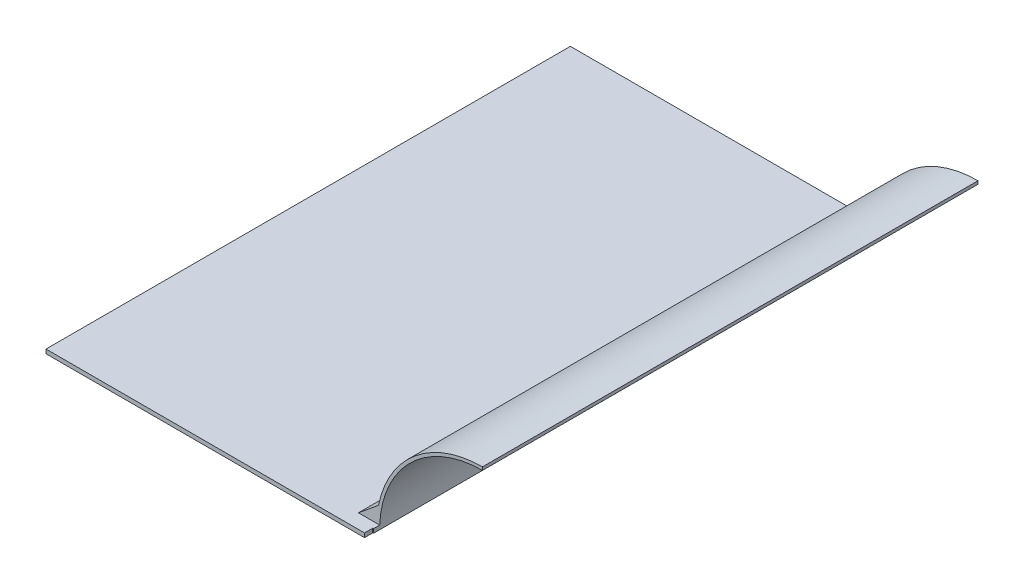
from build123d import *

# Parameters (mm, degrees)
BOSS_EXTRUDE1_DEPTH = 122.5
BOSS_EXTRUDE2_DEPTH = 5
FILLET1_R           = 0.6
BOSS_EXTRUDE3_DEPTH = 5
SKETCH6_W           = 154.900501524
SKETCH6_H           = 4.066396164
BOSS_EXTRUDE4_DEPTH = 5
CUT_EXTRUDE1_START  = -4
CUT_EXTRUDE1_DEPTH  = 4
BOSS_EXTRUDE5_START = 1
BOSS_EXTRUDE5_DEPTH = 1
CUT_EXTRUDE2_DEPTH  = 10
CUT_EXTRUDE3_DEPTH  = 1.066396
CUT_EXTRUDE4_DEPTH  = 1
CHAMFER1_START      = -123.5
CHAMFER1_DEPTH      = 247
SKETCH15_W          = 64.575281
SKETCH15_H          = 7
SKETCH15_W_2        = 62.115122
CUT_EXTRUDE5_DEPTH  = 70


with BuildPart() as part:
    # Sketch1 → Boss-Extrude1 (new, symmetric)
    with BuildSketch(Plane.XY):
        with BuildLine():
            Line((76.956830849, 0), (-76.956830849, 0))
            Line((-76.956830849, 0), (-76.956830849, -4.066396164))
            Line((-76.956830849, -4.066396164), (78.296976713, -4.066396164))
            ThreePointArc((78.296976713, -4.066396164), (92.937456554, 31.296585381), (128.296975316, 45.945426519))
            Line((128.296975316, 45.945426519), (128.296975316, 47.445426519))
            ThreePointArc((128.296975316, 47.445426519), (93.343867688, 33.767777941), (76.956830849, 0))
        make_face()
    extrude(amount=BOSS_EXTRUDE1_DEPTH, both=True)

    # Sketch4 → Boss-Extrude2 (add, symmetric)
    with BuildSketch(Plane.XY):
        Polygon((-75.056329325, -5), (-72.325824204, -5), (-71.690241182, -6.74625), (-71.191912346, -6.74625), (-70.556329325, -5), (-69.825824204, -5), (-69.190241182, -6.74625), (-68.691912346, -6.74625), (-68.056329325, -5), (-67.325824204, -5), (-66.690241182, -6.74625), (-66.191912346, -6.74625), (-65.556329325, -5), (-64.825824204, -5), (-64.190241182, -6.74625), (-63.691912346, -6.74625), (-63.056329325, -5), (-62.325824204, -5), (-61.690241182, -6.74625), (-61.191912346, -6.74625), (-60.556329325, -5), (-59.825824204, -5), (-59.190241182, -6.74625), (-58.691912346, -6.74625), (-58.056329325, -5), (-57.325824204, -5), (-56.690241182, -6.74625), (-56.191912346, -6.74625), (-55.556329325, -5), (-54.825824204, -5), (-54.190241182, -6.74625), (-53.691912346, -6.74625), (-53.056329325, -5), (-52.325824204, -5), (-51.690241182, -6.74625), (-51.191912346, -6.74625), (-50.556329325, -5), (-49.825824204, -5), (-49.190241182, -6.74625), (-48.691912346, -6.74625), (-48.056329325, -5), (-47.325824204, -5), (-46.690241182, -6.74625), (-46.191912346, -6.74625), (-45.556329325, -5), (-44.825824204, -5), (-44.190241182, -6.74625), (-43.691912346, -6.74625), (-43.056329325, -5), (-42.325824204, -5), (-41.690241182, -6.74625), (-41.191912346, -6.74625), (-40.556329325, -5), (-39.825824204, -5), (-39.190241182, -6.74625), (-38.691912346, -6.74625), (-38.056329325, -5), (-37.325824204, -5), (-36.690241182, -6.74625), (-36.191912346, -6.74625), (-35.556329325, -5), (-34.825824204, -5), (-34.190241182, -6.74625), (-33.691912346, -6.74625), (-33.056329325, -5), (-32.325824204, -5), (-31.690241182, -6.74625), (-31.191912346, -6.74625), (-30.556329325, -5), (-29.825824204, -5), (-29.190241182, -6.74625), (-28.691912346, -6.74625), (-28.056329325, -5), (-27.325824204, -5), (-26.690241182, -6.74625), (-26.191912346, -6.74625), (-25.556329325, -5), (-24.825824204, -5), (-24.190241182, -6.74625), (-23.691912346, -6.74625), (-23.056329325, -5), (-22.325824204, -5), (-21.690241182, -6.74625), (-21.191912346, -6.74625), (-20.556329325, -5), (-19.825824204, -5), (-19.190241182, -6.74625), (-18.691912346, -6.74625), (-18.056329325, -5), (-17.325824204, -5), (-16.690241182, -6.74625), (-16.191912346, -6.74625), (-15.556329325, -5), (-14.825824204, -5), (-14.190241182, -6.74625), (-13.691912346, -6.74625), (-13.056329325, -5), (-12.325824204, -5), (-11.690241182, -6.74625), (-11.191912346, -6.74625), (-10.556329325, -5), (-9.825824204, -5), (-9.190241182, -6.74625), (-8.691912346, -6.74625), (-8.056329325, -5), (-7.325824204, -5), (-6.690241182, -6.74625), (-6.191912346, -6.74625), (-5.556329325, -5), (-4.825824204, -5), (-4.190241182, -6.74625), (-3.691912346, -6.74625), (-3.056329325, -5), (-2.325824204, -5), (-1.690241182, -6.74625), (-1.191912346, -6.74625), (-0.556329325, -5), (0.174175796, -5), (0.809758818, -6.74625), (1.308087654, -6.74625), (1.943670675, -5), (2.674175796, -5), (3.309758818, -6.74625), (3.808087654, -6.74625), (4.443670675, -5), (5.174175796, -5), (5.809758818, -6.74625), (6.308087654, -6.74625), (6.943670675, -5), (7.674175796, -5), (8.309758818, -6.74625), (8.808087654, -6.74625), (9.443670675, -5), (10.174175796, -5), (10.809758818, -6.74625), (11.308087654, -6.74625), (11.943670675, -5), (12.674175796, -5), (13.309758818, -6.74625), (13.808087654, -6.74625), (14.443670675, -5), (15.174175796, -5), (15.809758818, -6.74625), (16.308087654, -6.74625), (16.943670675, -5), (17.674175796, -5), (18.309758818, -6.74625), (18.808087654, -6.74625), (19.443670675, -5), (20.174175796, -5), (20.809758818, -6.74625), (21.308087654, -6.74625), (21.943670675, -5), (22.674175796, -5), (23.309758818, -6.74625), (23.808087654, -6.74625), (24.443670675, -5), (25.174175796, -5), (25.809758818, -6.74625), (26.308087654, -6.74625), (26.943670675, -5), (27.674175796, -5), (28.309758818, -6.74625), (28.808087654, -6.74625), (29.443670675, -5), (30.174175796, -5), (30.809758818, -6.74625), (31.308087654, -6.74625), (31.943670675, -5), (32.674175796, -5), (33.309758818, -6.74625), (33.808087654, -6.74625), (34.443670675, -5), (35.174175796, -5), (35.809758818, -6.74625), (36.308087654, -6.74625), (36.943670675, -5), (37.674175796, -5), (38.309758818, -6.74625), (38.808087654, -6.74625), (39.443670675, -5), (40.174175796, -5), (40.809758818, -6.74625), (41.308087654, -6.74625), (41.943670675, -5), (42.674175796, -5), (43.309758818, -6.74625), (43.808087654, -6.74625), (44.443670675, -5), (45.174175796, -5), (45.809758818, -6.74625), (46.308087654, -6.74625), (46.943670675, -5), (47.674175796, -5), (48.309758818, -6.74625), (48.808087654, -6.74625), (49.443670675, -5), (50.174175796, -5), (50.809758818, -6.74625), (51.308087654, -6.74625), (51.943670675, -5), (52.674175796, -5), (53.309758818, -6.74625), (53.808087654, -6.74625), (54.443670675, -5), (55.174175796, -5), (55.809758818, -6.74625), (56.308087654, -6.74625), (56.943670675, -5), (57.674175796, -5), (58.309758818, -6.74625), (58.808087654, -6.74625), (59.443670675, -5), (60.174175796, -5), (60.809758818, -6.74625), (61.308087654, -6.74625), (61.943670675, -5), (62.674175796, -5), (63.309758818, -6.74625), (63.808087654, -6.74625), (64.443670675, -5), (65.174175796, -5), (65.809758818, -6.74625), (66.308087654, -6.74625), (66.943670675, -5), (67.674175796, -5), (68.309758818, -6.74625), (68.808087654, -6.74625), (69.443670675, -5), (70.174175796, -5), (70.809758818, -6.74625), (71.308087654, -6.74625), (71.943670675, -5), (71.943670675, -4.066396164), (-75.056329325, -4.066396164), align=None)
    extrude(amount=BOSS_EXTRUDE2_DEPTH, both=True)

    # Fillet1
    fillet1_edges = [part.edges().sort_by_distance(p)[0] for p in [
        (-1.556329325, -4.066396164, -5),
        (71.943670675, -4.066396164, 0),
        (-1.556329325, -4.066396164, 5),
    ]]
    fillet(fillet1_edges, radius=FILLET1_R)

    # Sketch5 → Boss-Extrude3 (add)
    with BuildSketch(Plane(origin=(0, 0, -122.5), x_dir=(-1, 0, 0), z_dir=(0, 0, -1))):
        with BuildLine():
            ThreePointArc((-128.296975316, 45.945426519), (-92.937456554, 31.296585381), (-78.296976713, -4.066396164))
            Line((-78.296976713, -4.066396164), (76.956830849, -4.066396164))
            Line((76.956830849, -4.066396164), (76.956830849, 0))
            Line((76.956830849, 0), (-76.956830849, 0))
            ThreePointArc((-76.956830849, 0), (-93.343867688, 33.767777941), (-128.296975316, 47.445426519))
            Line((-128.296975316, 47.445426519), (-128.296975316, 45.945426519))
        make_face()
    extrude(amount=BOSS_EXTRUDE3_DEPTH)

    # Sketch6 → Boss-Extrude4 (add)
    with BuildSketch(Plane.XY.offset(122.5)):
        with Locations((0.493419913, -2.033198082)):
            Rectangle(SKETCH6_W, SKETCH6_H)
    extrude(amount=BOSS_EXTRUDE4_DEPTH)

    # Sketch7 → Cut-Extrude1 (cut)
    with BuildSketch(Plane(origin=(0, 0, -127.5), x_dir=(-1, 0, 0), z_dir=(0, 0, -1)).offset(CUT_EXTRUDE1_START)):
        with BuildLine():
            Line((-78.461642128, 0), (-76.956830849, 0))
            ThreePointArc((-76.956830849, 0), (-93.343867688, 33.767777941), (-128.296975316, 47.445426519))
            Line((-128.296975316, 47.445426519), (-128.296975316, 45.945426519))
            ThreePointArc((-128.296975316, 45.945426519), (-94.405447422, 32.706334247), (-78.461642128, 0))
        make_face()
    extrude(amount=CUT_EXTRUDE1_DEPTH, mode=Mode.SUBTRACT)

    # Sketch8 → Boss-Extrude5 (add)
    with BuildSketch(Plane.XY.offset(122.5).offset(BOSS_EXTRUDE5_START)):
        with BuildLine():
            Line((76.956830849, 0), (77.943670675, 0))
            Line((77.943670675, 0), (77.943670675, -4.066396164))
            Line((77.943670675, -4.066396164), (78.296976713, -4.066396164))
            ThreePointArc((78.296976713, -4.066396164), (92.937456554, 31.296585381), (128.296975316, 45.945426519))
            Line((128.296975316, 45.945426519), (128.296975316, 47.445426519))
            ThreePointArc((128.296975316, 47.445426519), (93.343867688, 33.767777941), (76.956830849, 0))
        make_face()
    extrude(amount=-BOSS_EXTRUDE5_DEPTH)

    # Sketch9 → Cut-Extrude2 (cut)
    with BuildSketch(Plane.XZ.offset(4.066396164)):
        Polygon((79.518110065, -125.916070286), (80.676652707, -125.916070286), (80.676652707, -127.5), (78.296976713, -127.5), (74.296976713, -127.5), (74.296976713, -125.916070286), align=None)
    extrude(amount=-CUT_EXTRUDE2_DEPTH, mode=Mode.SUBTRACT)

    # Sketch13 → Cut-Extrude3 (cut)
    with BuildSketch(Plane(origin=(0, 0, 0), x_dir=(1, 0, 0), z_dir=(0, 1, 0))):
        Polygon((78.461642128, 125.916070286), (74.296976713, 125.916070286), (74.296976713, 127.5), (-76.956830849, 127.5), (-76.956830849, -127.5), (77.943670675, -127.5), (77.943670675, -123.5), (76.956830849, -123.5), (76.956830849, 123.5), (78.461642128, 123.5), align=None)
    extrude(amount=-CUT_EXTRUDE3_DEPTH, mode=Mode.SUBTRACT)

    # Sketch14 → Cut-Extrude4 (cut)
    with BuildSketch(Plane(origin=(0, -1.066396, 0), x_dir=(1, 0, 0), z_dir=(0, 1, 0))):
        Polygon((78.386347236, 123.5), (78.386347236, 125.916070286), (74.296976713, 125.916070286), (74.296976713, 127.5), (-76.956830849, 127.5), (-76.956830849, -127.5), (77.943670675, -127.5), (77.943670675, -123.5), (76.956830849, -123.5), (76.956830849, 123.5), align=None)
    extrude(amount=-CUT_EXTRUDE4_DEPTH, mode=Mode.SUBTRACT)

    # Chamfer1: read off the stored shape, not the designer's step
    # Chamfer1 outline → Chamfer1 (add)
    with BuildSketch(Plane.XY.offset(CHAMFER1_START)):
        with BuildLine():
            Line((77.784888825, 5.984306849), (67.97671669, -2.066396))
            Line((67.97671669, -2.066396), (76.956830849, -2.066396))
            Line((76.956830849, -2.066396), (76.956830849, 0))
            ThreePointArc((76.956830849, 0), (77.283033889, 3.004306039), (77.784888825, 5.984306849))
        make_face()
    extrude(amount=CHAMFER1_DEPTH)

    # Sketch15 → Cut-Extrude5 (cut)
    with BuildSketch(Plane(origin=(0, -2.066396, 0), x_dir=(1, 0, 0), z_dir=(0, 1, 0))):
        with Locations((100.26435719, 124)):
            Rectangle(SKETCH15_W, SKETCH15_H)
        with Locations((99.03427769, -124)):
            Rectangle(SKETCH15_W_2, SKETCH15_H)
    extrude(amount=CUT_EXTRUDE5_DEPTH, mode=Mode.SUBTRACT)


solid = part.part
